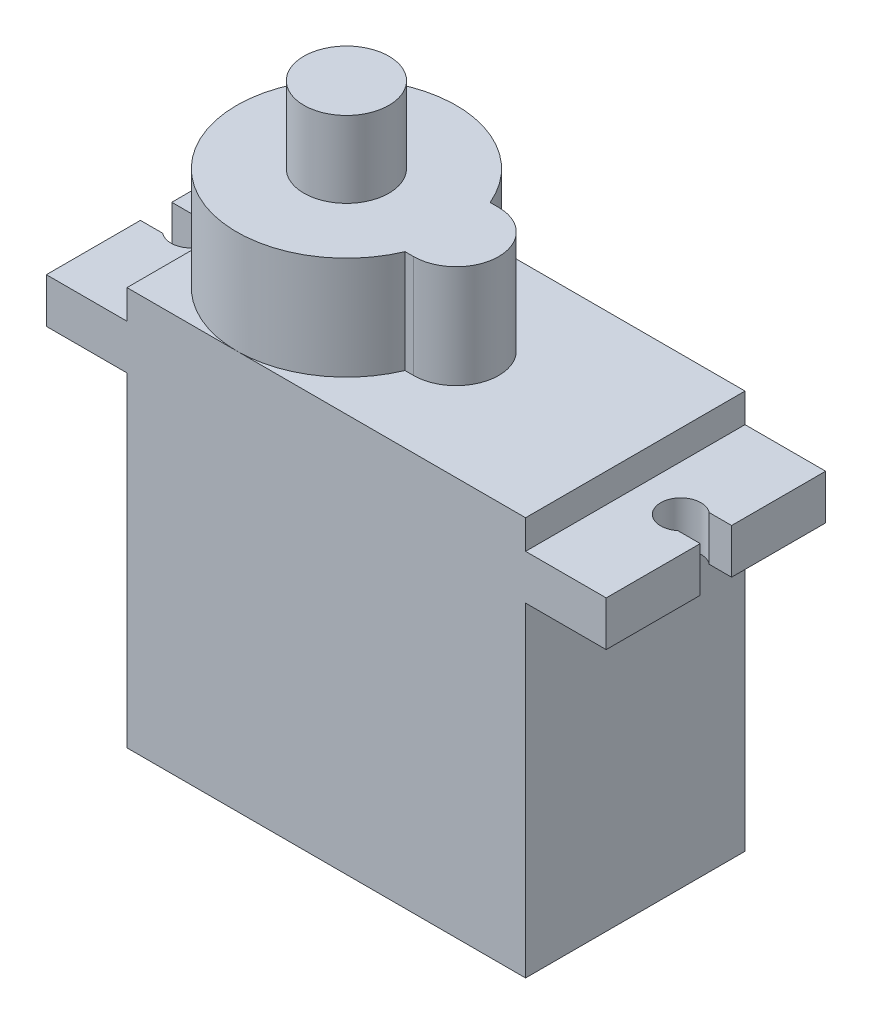
from build123d import *

# Parameters (mm, degrees)
SKETCH1_W           = 22.606
SKETCH1_H           = 12.446
BOSS_EXTRUDE1_DEPTH = 18.415
BOSS_EXTRUDE2_DEPTH = 2.54
SKETCH3_W           = 22.606
SKETCH3_H           = 12.446
BOSS_EXTRUDE3_DEPTH = 1.651
BOSS_EXTRUDE4_DEPTH = 5.842
SKETCH5_R           = 2.413
BOSS_EXTRUDE5_DEPTH = 4.318


with BuildPart() as part:
    # Sketch1 → Boss-Extrude1 (new body)
    with BuildSketch(Plane(origin=(0, 0, 0), x_dir=(1, 0, 0), z_dir=(0, 1, 0))):
        Rectangle(SKETCH1_W, SKETCH1_H)
    extrude(amount=BOSS_EXTRUDE1_DEPTH)

    # Sketch2 → Boss-Extrude2 (add)
    with BuildSketch(Plane(origin=(0, 18.415, 0), x_dir=(1, 0, 0), z_dir=(0, 1, 0))):
        with BuildLine():
            Line((15.875, -6.223), (-15.875, -6.223))
            Line((-15.875, -6.223), (-15.875, -0.889))
            Line((-15.875, -0.889), (-14.605, -0.889))
            ThreePointArc((-14.605, -0.889), (-12.74357951, 0), (-14.605, 0.889))
            Line((-14.605, 0.889), (-15.875, 0.889))
            Line((-15.875, 0.889), (-15.875, 6.223))
            Line((-15.875, 6.223), (15.875, 6.223))
            Line((15.875, 6.223), (15.875, 0.889))
            Line((15.875, 0.889), (14.605, 0.889))
            ThreePointArc((14.605, 0.889), (12.74357951, 0), (14.605, -0.889))
            Line((14.605, -0.889), (15.875, -0.889))
            Line((15.875, -0.889), (15.875, -6.223))
        make_face()
    extrude(amount=BOSS_EXTRUDE2_DEPTH)

    # Sketch3 → Boss-Extrude3 (add)
    with BuildSketch(Plane(origin=(0, 20.955, 0), x_dir=(1, 0, 0), z_dir=(0, 1, 0))):
        Rectangle(SKETCH3_W, SKETCH3_H)
    extrude(amount=BOSS_EXTRUDE3_DEPTH)

    # Sketch4 → Boss-Extrude4 (add)
    with BuildSketch(Plane(origin=(0, 22.606, 0), x_dir=(1, 0, 0), z_dir=(0, 1, 0))):
        with BuildLine():
            ThreePointArc((1.143, -2.413), (3.556, 0), (1.143, 2.413))
            Line((1.143, 2.413), (0.656127614, 2.413))
            ThreePointArc((0.656127614, 2.413), (-6.310814133, 6.100067669), (-11.303, 0))
            ThreePointArc((-11.303, 0), (-6.310814133, -6.100067669), (0.656127614, -2.413))
            Line((0.656127614, -2.413), (1.143, -2.413))
        make_face()
    extrude(amount=BOSS_EXTRUDE4_DEPTH)

    # Sketch5 → Boss-Extrude5 (add)
    with BuildSketch(Plane(origin=(0, 28.448, 0), x_dir=(1, 0, 0), z_dir=(0, 1, 0))):
        with Locations((-5.08, 0)):
            Circle(SKETCH5_R)
    extrude(amount=BOSS_EXTRUDE5_DEPTH)


solid = part.part
